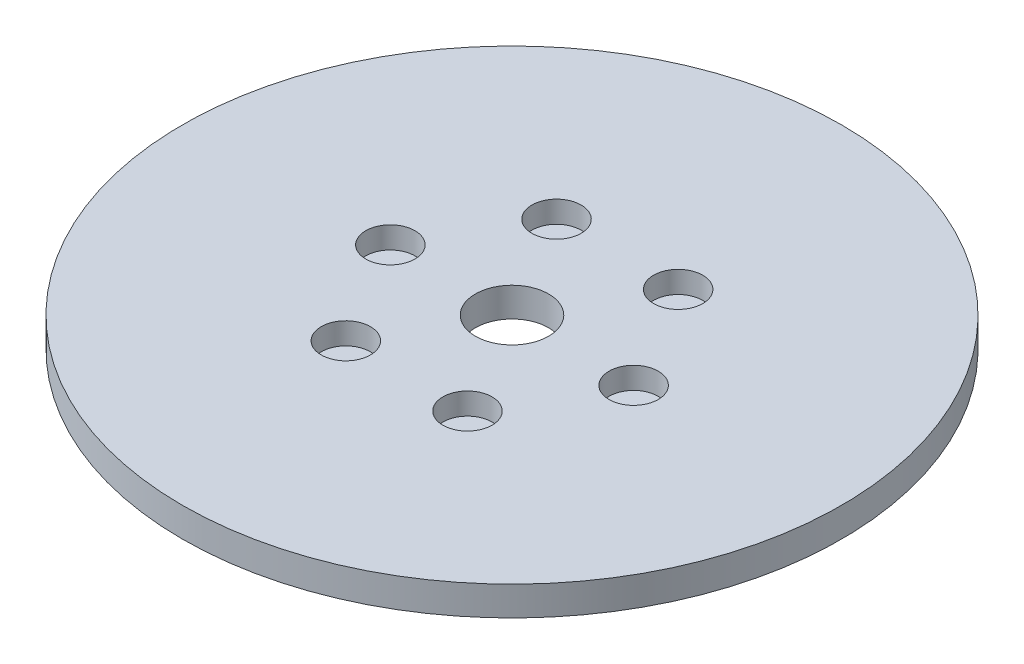
from build123d import *

# Parameters (mm, degrees)
SKETCH1_R           = 90
BOSS_EXTRUDE1_DEPTH = 8
SKETCH2_R           = 10
CUT_EXTRUDE1_DEPTH  = 128.530388535
SKETCH3_R           = 6.71427462
CUT_EXTRUDE2_DEPTH  = 5.957200942
CIRPATTERN1_COUNT   = 6


with BuildPart() as part:
    # Sketch1 → Boss-Extrude1 (new body)
    with BuildSketch(Plane(origin=(0, 0, 0), x_dir=(1, 0, 0), z_dir=(0, 1, 0))):
        Circle(SKETCH1_R)
    extrude(amount=BOSS_EXTRUDE1_DEPTH)

    # Sketch2 → Cut-Extrude1 (cut, through all)
    with BuildSketch(Plane(origin=(0, 0, 0), x_dir=(1, 0, 0), z_dir=(0, 1, 0))):
        Circle(SKETCH2_R)
    extrude(amount=CUT_EXTRUDE1_DEPTH, mode=Mode.SUBTRACT)

    # Sketch3 → Cut-Extrude2 (cut)
    with BuildSketch(Plane(origin=(0, 8, 0), x_dir=(1, 0, 0), z_dir=(0, 1, 0))):
        with Locations((-33.217796335, 0)):
            Circle(SKETCH3_R)
    cut_extrude2 = extrude(amount=-CUT_EXTRUDE2_DEPTH, mode=Mode.SUBTRACT)

    # CirPattern1: Cut-Extrude2 ×6 about axis
    cirpattern1_axis = Axis((0, 0, 0), (0, 1, 0))
    for i in range(1, CIRPATTERN1_COUNT):
        add(cut_extrude2.rotate(cirpattern1_axis, i * 360 / CIRPATTERN1_COUNT), mode=Mode.SUBTRACT)


solid = part.part
